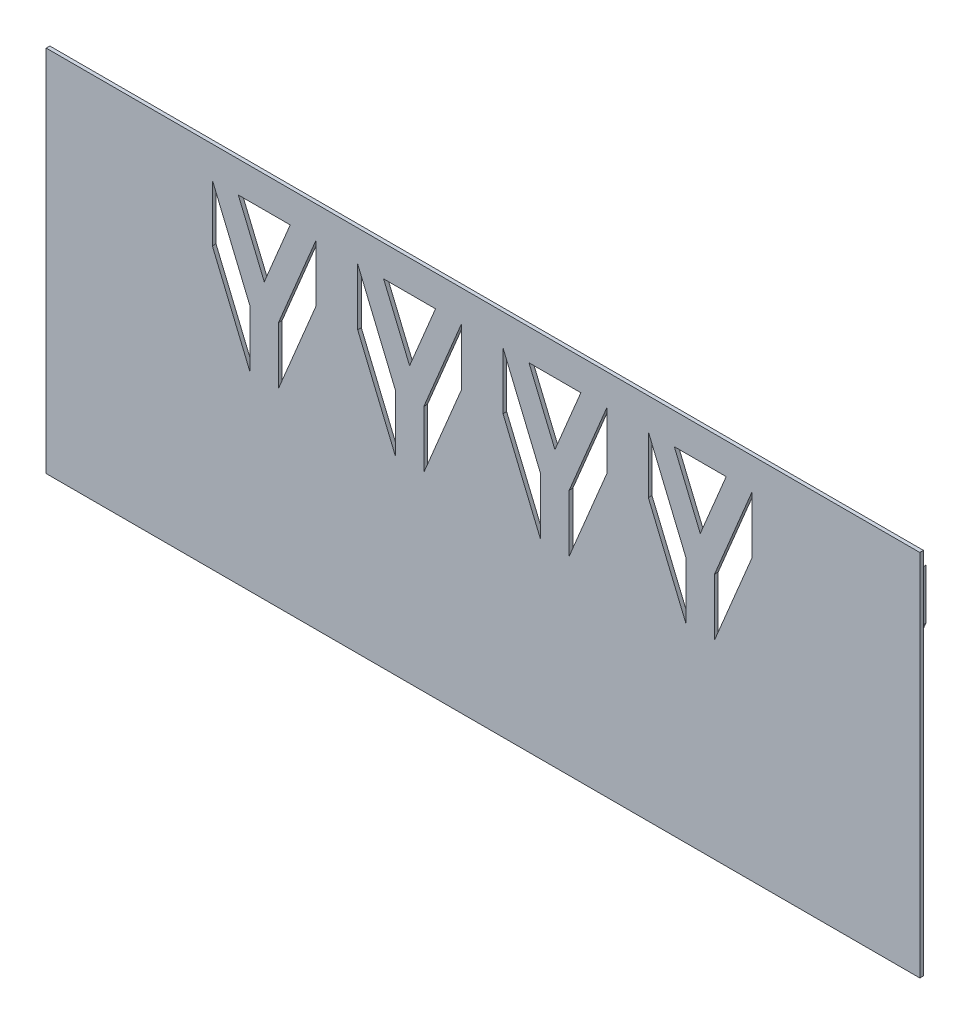
from build123d import *

# Parameters (mm, degrees)
SKETCH2_W           = 168.310893
SKETCH2_H           = 71
BOSS_EXTRUDE3_DEPTH = 0.7
BOSS_EXTRUDE5_DEPTH = 5


with BuildPart() as part:
    # Sketch2 → Boss-Extrude3 (new body)
    with BuildSketch(Plane.XY):
        with Locations((84.1554465, -35.5)):
            Rectangle(SKETCH2_W, SKETCH2_H)
        Polygon((32.004849, -17), (32.004849, -11.5), (32.004849, -6), (39.254849, -23.4), (39.254849, -34.4), align=None, mode=Mode.SUBTRACT)
        Polygon((52.004849, -6), (52.004849, -17), (44.754849, -34.4), (44.754849, -23.4), align=None, mode=Mode.SUBTRACT)
        Polygon((67.254849, -34.4), (60.004849, -17), (60.004849, -6), (67.254849, -23.4), align=None, mode=Mode.SUBTRACT)
        Polygon((80.004849, -17), (72.754849, -34.4), (72.754849, -23.4), (80.004849, -6), align=None, mode=Mode.SUBTRACT)
        Polygon((42.004849, -18), (37.004849, -6), (47.004849, -6), align=None, mode=Mode.SUBTRACT)
        Polygon((75.004849, -6), (70.004849, -18), (65.004849, -6), align=None, mode=Mode.SUBTRACT)
        Polygon((95.254849, -23.4), (95.254849, -34.4), (88.004849, -17), (88.004849, -6), align=None, mode=Mode.SUBTRACT)
        Polygon((100.754849, -23.4), (108.004849, -6), (108.004849, -17), (100.754849, -34.4), align=None, mode=Mode.SUBTRACT)
        Polygon((123.254849, -34.4), (116.004849, -17), (116.004849, -6), (123.254849, -23.4), align=None, mode=Mode.SUBTRACT)
        Polygon((136.004849, -6), (136.004849, -17), (128.754849, -34.4), (128.754849, -23.4), align=None, mode=Mode.SUBTRACT)
        Polygon((98.004849, -18), (93.004849, -6), (103.004849, -6), align=None, mode=Mode.SUBTRACT)
        Polygon((131.004849, -6), (126.004849, -18), (121.004849, -6), align=None, mode=Mode.SUBTRACT)
    extrude(amount=BOSS_EXTRUDE3_DEPTH)

    # Sketch2<6> → Boss-Extrude5 (add)
    with BuildSketch(Plane.XY):
        Polygon((158.629849, -6.25), (149.379849, -6.25), (154.004849, -17.35), align=None)
        Polygon((144.254849, -16.95), (151.004849, -33.15), (151.004849, -23.45), (144.254849, -7.25), align=None)
        Polygon((163.754849, -7.25), (157.004849, -23.45), (157.004849, -33.15), (163.754849, -16.95), align=None)
        Polygon((18.629849, -6.25), (9.379849, -6.25), (14.004849, -17.35), align=None)
        Polygon((11.004849, -23.45), (4.254849, -7.25), (4.254849, -16.95), (11.004849, -33.15), align=None)
        Polygon((23.754849, -16.95), (23.754849, -7.25), (17.004849, -23.45), (17.004849, -33.15), align=None)
    extrude(amount=-BOSS_EXTRUDE5_DEPTH)


solid = part.part
